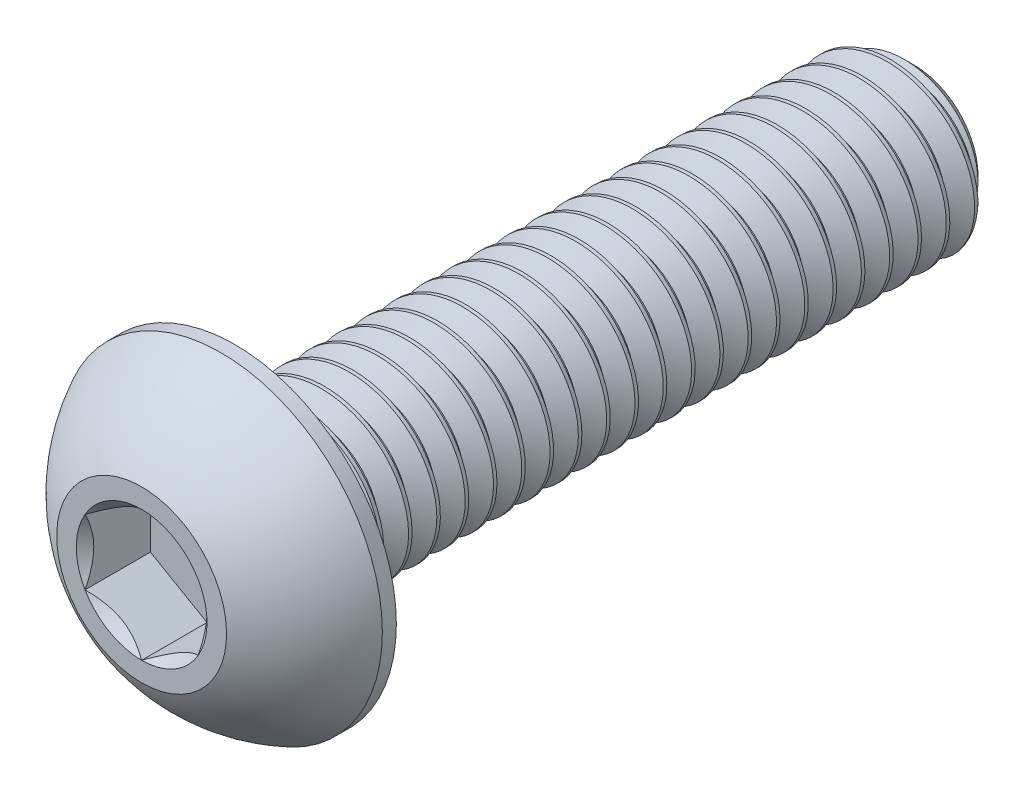
from build123d import *

# Parameters (mm, degrees)
SKETCH1_W          = 12
SKETCH1_H          = 1.5
CHAMFER1_SIZE      = 0.375
CUT_SWEEP1_PITCH   = 0.5
CUT_EXTRUDE2_DEPTH = 1.155


with BuildPart() as part:
    # Sketch1 → Revolve1 (revolve)
    with BuildSketch(Plane(origin=(0, 0, 0), x_dir=(0, 0, -1), z_dir=(1, 0, 0))):
        with Locations((7.65, 0.75)):
            Rectangle(SKETCH1_W, SKETCH1_H)
    revolve(axis=Axis((0, 0, -13.65), (0, 0, 1)))

    # Chamfer1
    chamfer1_edges = [part.edges().sort_by_distance(p)[0] for p in [
        (0, -1.5, -13.65),
    ]]
    chamfer(chamfer1_edges, length=CHAMFER1_SIZE)

    # Cut-Sweep1: the profile of Sketch2 profile screwed along a right-hand helix of 25 turns, 6 arcs to a turn; built about Z, then put on its axis
    cut_sweep1_z = Axis((0, 0, 0), (0, 0, 1))
    cut_sweep1_corners = [(1.5003, 0, 0.000173205), (1.5003, 0, -0.437673205), (1.175240474, 0, -0.25), (1.175240474, 0, -0.1875)]
    with BuildLine(mode=Mode.PRIVATE) as cut_sweep1_profile:
        Line(cut_sweep1_corners[0], cut_sweep1_corners[1])
        Line(cut_sweep1_corners[1], cut_sweep1_corners[2])
        Line(cut_sweep1_corners[2], cut_sweep1_corners[3])
        Line(cut_sweep1_corners[3], cut_sweep1_corners[0])
    cut_sweep1_cap = Face(cut_sweep1_profile.wire())
    cut_sweep1_turn_angles = [0, 30, 60, 90, 120, 150, 180, 210, 240, 270, 300, 330, 360]
    cut_sweep1_turn_weights = [1, 0.8660254037844387, 1, 0.8660254037844387, 1, 0.8660254037844387, 1, 0.8660254037844387, 1, 0.8660254037844387, 1, 0.8660254037844387, 1]
    cut_sweep1_turn_rails = [Edge.make_bspline([Vector(p[0], p[1], 0).rotate(cut_sweep1_z, cut_sweep1_turn_angles[k]) / cut_sweep1_turn_weights[k] + Vector(0, 0, p[2] + CUT_SWEEP1_PITCH * cut_sweep1_turn_angles[k] / 360) for k in range(13)], [0, 0, 0, 1, 1, 2, 2, 3, 3, 4, 4, 5, 5, 6, 6, 6], 2, cut_sweep1_turn_weights) for p in cut_sweep1_corners]
    cut_sweep1_turn_sides = [Face.make_surface_from_curves(cut_sweep1_turn_rails[p[0]], cut_sweep1_turn_rails[p[1]]) for p in [(0, 1), (1, 2), (2, 3), (3, 0)]]
    cut_sweep1 = Plane(origin=(0, 0, -13.65), x_dir=(0, 1, 0), z_dir=(0, 0, 1)) * Solid(Shell([*[p.moved(Location((0, 0, CUT_SWEEP1_PITCH * i))) for i in range(25) for p in cut_sweep1_turn_sides], cut_sweep1_cap, cut_sweep1_cap.rotate(cut_sweep1_z, 9000).moved(Location((0, 0, CUT_SWEEP1_PITCH * 9000 / 360)))]))
    add(cut_sweep1, mode=Mode.SUBTRACT)

    # Sketch7 → Revolve2 (revolve)
    with BuildSketch(Plane(origin=(0, 0, 0), x_dir=(0, 0, -1), z_dir=(1, 0, 0)), mode=Mode.PRIVATE) as revolve2_sk:
        with BuildLine():
            Line((1.4025, 2.85), (1.65, 2.85))
            Line((1.65, 2.85), (1.65, 0))
            Line((1.65, 0), (0, 0))
            Line((0, 0), (0, 1.5))
            ThreePointArc((0, 1.5), (0.59512511, 2.285251969), (1.4025, 2.85))
        make_face()
    revolve(revolve2_sk.sketch.rotate(Axis((0, 0, 0), (0, 0, -1)), 189.336081704), axis=Axis((0, 0, 0), (0, 0, -1)))

    # Sketch5 → Cut-Extrude2 (cut)
    with BuildSketch(Plane.XY):
        Polygon((1, -0.577350269), (1, 0.577350269), (0, 1.154700538), (-1, 0.577350269), (-1, -0.577350269), (0, -1.154700538), align=None)
    extrude(amount=-CUT_EXTRUDE2_DEPTH, mode=Mode.SUBTRACT)

    # Cut-Extrude3 cone 1 section (through the dimple's axis) → Cut-Extrude3 (revolve, cut)
    with BuildSketch(Plane(origin=(0, 0, 0), x_dir=(0, -1, 0), z_dir=(1, 0, 0))):
        Polygon((0, 0), (1.154700538, 0), (0, 1.154700538), align=None)
    revolve(axis=Axis((0, 0, 0), (0, 0, -1)), mode=Mode.SUBTRACT)


solid = part.part
